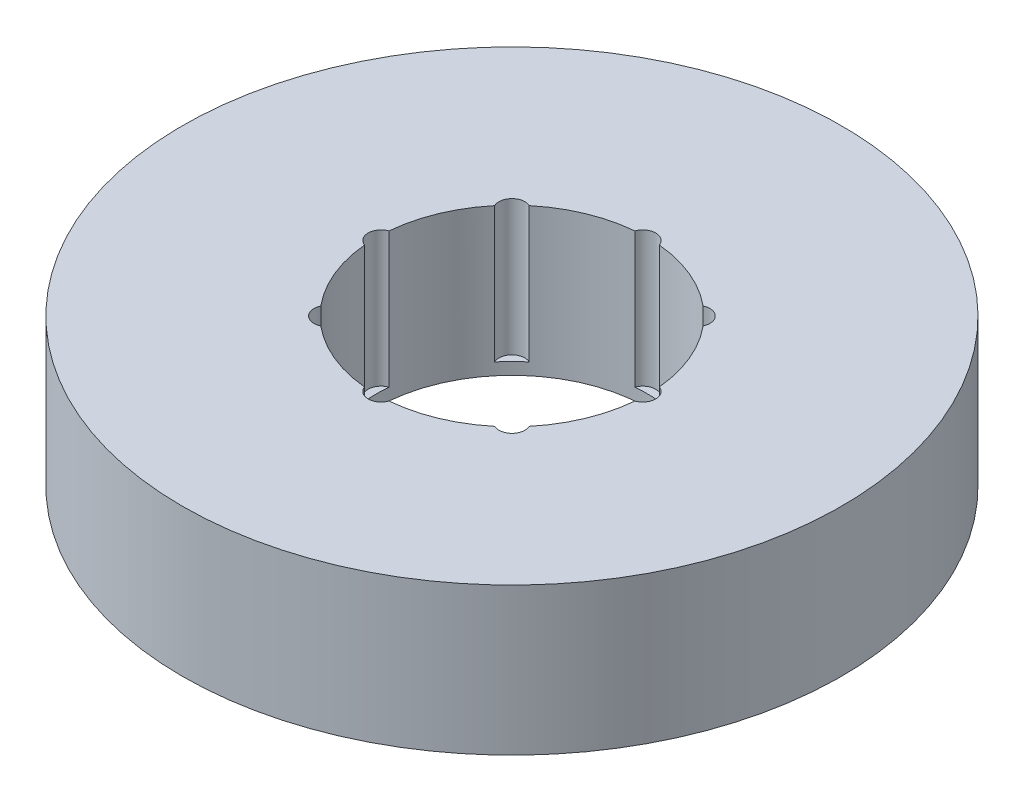
from build123d import *

# Parameters (mm, degrees)
SKETCH1_R           = 42.5
BOSS_EXTRUDE1_DEPTH = 19
SKETCH2_R           = 17.5
CUT_EXTRUDE1_DEPTH  = 64.035704168
SKETCH3_R           = 1.669842058
CUT_EXTRUDE2_DEPTH  = 17.453977875
CIRPATTERN1_COUNT   = 8


with BuildPart() as part:
    # Sketch1 → Boss-Extrude1 (new body)
    with BuildSketch(Plane(origin=(0, 0, 0), x_dir=(1, 0, 0), z_dir=(0, 1, 0))):
        Circle(SKETCH1_R)
    extrude(amount=BOSS_EXTRUDE1_DEPTH)

    # Sketch2 → Cut-Extrude1 (cut, through all)
    with BuildSketch(Plane(origin=(0, 0, 0), x_dir=(1, 0, 0), z_dir=(0, 1, 0))):
        Circle(SKETCH2_R)
    extrude(amount=CUT_EXTRUDE1_DEPTH, mode=Mode.SUBTRACT)

    # Sketch3 → Cut-Extrude2 (cut)
    with BuildSketch(Plane(origin=(0, 19, 0), x_dir=(1, 0, 0), z_dir=(0, 1, 0))):
        with Locations((-16.871786878, 0)):
            Circle(SKETCH3_R)
    cut_extrude2 = extrude(amount=-CUT_EXTRUDE2_DEPTH, mode=Mode.SUBTRACT)

    # CirPattern1: Cut-Extrude2 ×8 about axis
    cirpattern1_axis = Axis((0, 0, 0), (0, 1, 0))
    for i in range(1, CIRPATTERN1_COUNT):
        add(cut_extrude2.rotate(cirpattern1_axis, i * 360 / CIRPATTERN1_COUNT), mode=Mode.SUBTRACT)


solid = part.part
